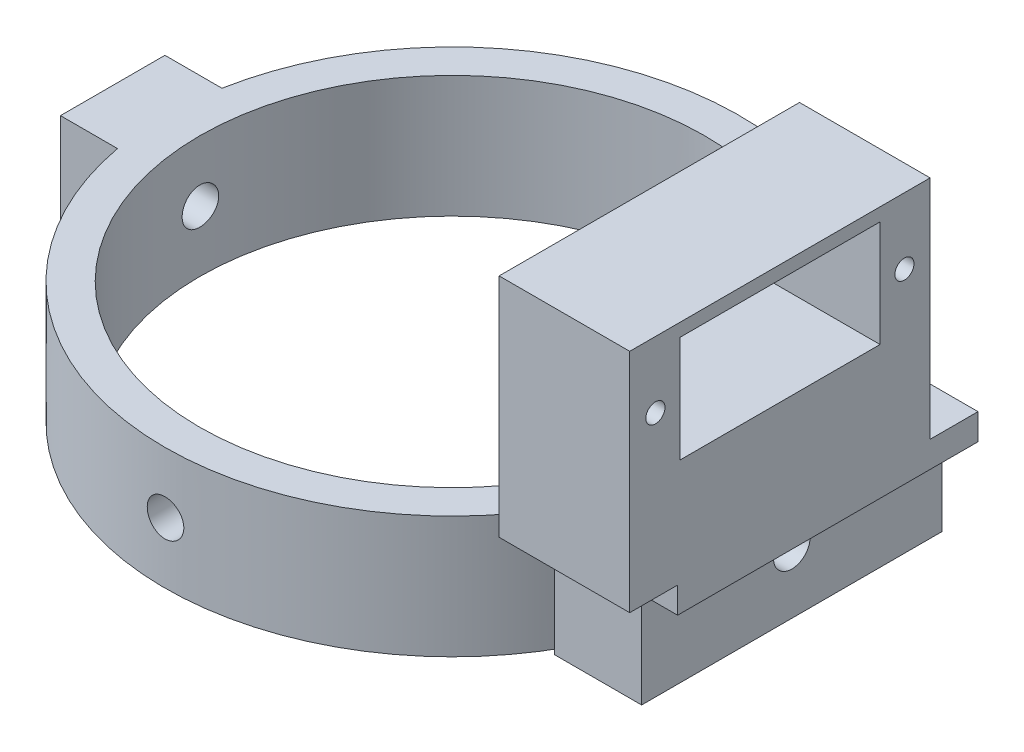
from build123d import *

# Parameters (mm, degrees)
SKETCH1_R               = 33
SKETCH1_R_2             = 29
BOSS_EXTRUDE1_DEPTH     = 7
SKETCH2_W               = 10
SKETCH2_H               = 34.5
SKETCH2_H_2             = 12
BOSS_EXTRUDE2_DEPTH     = 7
SKETCH5_R               = 2.1
CUT_EXTRUDE1_DEPTH      = 85.982351109
CUT_EXTRUDE4_DEPTH      = 36.5
CUT_EXTRUDE4_DEPTH_BACK = 46.5
SKETCH7_R               = 2.1
BOSS_EXTRUDE3_START     = 5.5
SKETCH11_W              = 15
SKETCH11_H              = 26
BOSS_EXTRUDE3_DEPTH     = 17.25
SKETCH12_W              = 14.128921921
SKETCH12_H              = 3
BOSS_EXTRUDE4_DEPTH     = 17.25
SKETCH13_R              = 1.1
SKETCH13_W              = 23
SKETCH13_H              = 12.2
CUT_EXTRUDE5_DEPTH      = 82.760457702


with BuildPart() as part:
    # Sketch1 → Boss-Extrude1 (new, symmetric)
    with BuildSketch(Plane(origin=(0, 0, 0), x_dir=(1, 0, 0), z_dir=(0, 1, 0))):
        Circle(SKETCH1_R)
        Circle(SKETCH1_R_2, mode=Mode.SUBTRACT)
    extrude(amount=BOSS_EXTRUDE1_DEPTH, both=True)

    # Sketch2 → Boss-Extrude2 (add, symmetric)
    with BuildSketch(Plane(origin=(0, 0, 0), x_dir=(1, 0, 0), z_dir=(0, 1, 0))):
        with Locations((34, 0)):
            Rectangle(SKETCH2_W, SKETCH2_H)
        with Locations((-34, 0)):
            Rectangle(SKETCH2_W, SKETCH2_H_2)
    extrude(amount=BOSS_EXTRUDE2_DEPTH, both=True)

    # Sketch5 → Cut-Extrude1 (cut, through all)
    with BuildSketch(Plane.ZY.offset(39)):
        Circle(SKETCH5_R)
    extrude(amount=-CUT_EXTRUDE1_DEPTH, mode=Mode.SUBTRACT)

    # Sketch7 → Cut-Extrude4 (cut, two sides: drawn at the far end of the back side and taken through both)
    with BuildSketch(Plane.XY.offset(-CUT_EXTRUDE4_DEPTH_BACK)):
        Circle(SKETCH7_R)
    extrude(amount=CUT_EXTRUDE4_DEPTH + CUT_EXTRUDE4_DEPTH_BACK, mode=Mode.SUBTRACT)

    # Sketch11 → Boss-Extrude3 (add, symmetric)
    with BuildSketch(Plane.XY.offset(BOSS_EXTRUDE3_START)):
        with Locations((35.632499, 20)):
            Rectangle(SKETCH11_W, SKETCH11_H)
    extrude(amount=BOSS_EXTRUDE3_DEPTH, both=True)

    # Sketch12 → Boss-Extrude4 (add, symmetric)
    with BuildSketch(Plane.XY):
        with Locations((36.06803804, 5.5)):
            Rectangle(SKETCH12_W, SKETCH12_H)
    extrude(amount=BOSS_EXTRUDE4_DEPTH, both=True)

    # Sketch13 → Cut-Extrude5 (cut, through all)
    with BuildSketch(Plane.ZY.offset(-28.132499)):
        with Locations((-8.8, 25.4)):
            Circle(SKETCH13_R)
        with Locations((19.8, 25.4)):
            Circle(SKETCH13_R)
        with Locations((5.5, 25.4)):
            Rectangle(SKETCH13_W, SKETCH13_H)
    extrude(amount=-CUT_EXTRUDE5_DEPTH, mode=Mode.SUBTRACT)


solid = part.part
